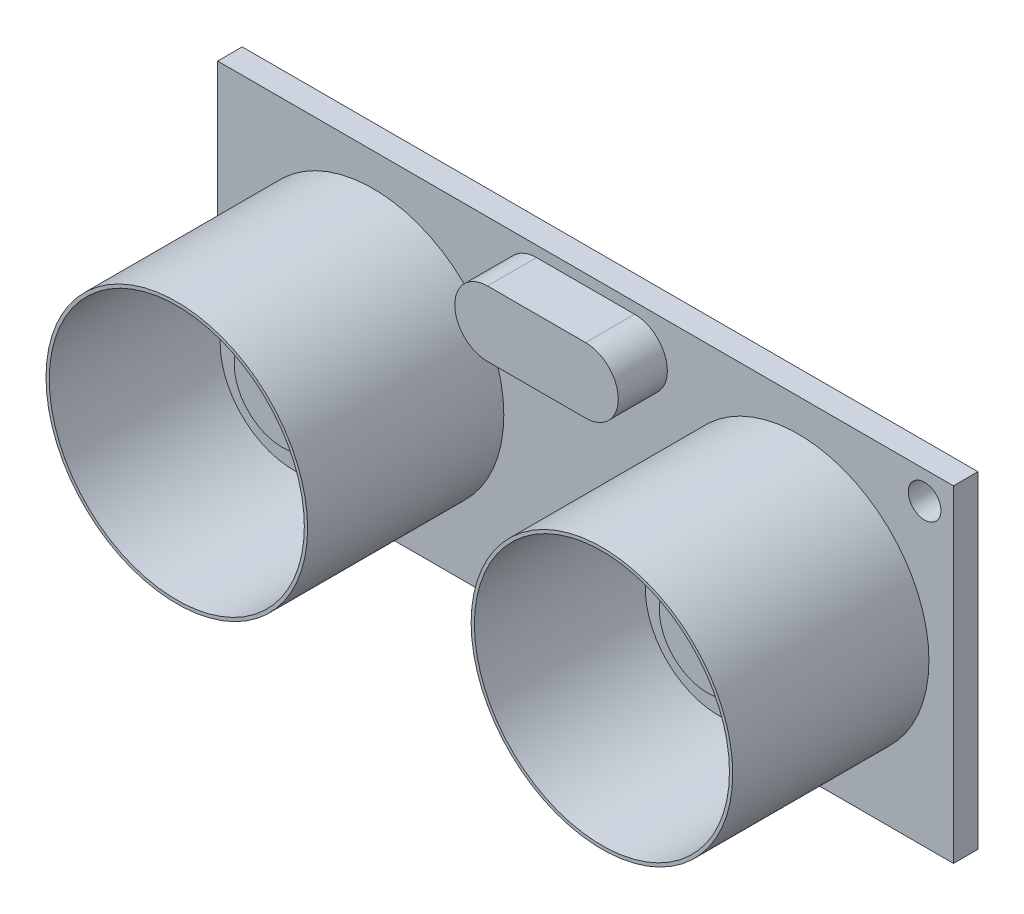
from build123d import *

# Parameters (mm, degrees)
CROQUIS1_W                = 45
CROQUIS1_H                = 20
CROQUIS1_R                = 1
SALIENTE_EXTRUIR1_DEPTH   = 1.5
CROQUIS2_R                = 8
SALIENTE_EXTRUIR2_DEPTH   = 12
CROQUIS4_W                = 2
CROQUIS4_H                = 2
SALIENTE_EXTRUIR4_DEPTH   = 2
REDONDEO3_R               = 0.2
SALIENTE_EXTRUIR6_DEPTH   = 3
VACIADO1_START            = 0.2
VACIADO1_OUTLINE_R        = 7.8
VACIADO1_DEPTH            = 13.1
VACIADO1_2_OUTLINE_W      = 44.6
VACIADO1_2_OUTLINE_H      = 19.6
VACIADO1_2_OUTLINE_R      = 1.2
VACIADO1_2_OUTLINE_R_2    = 7.8
VACIADO1_2_DEPTH          = 1.1
VACIADO1_START_2          = 1.3
VACIADO1_3_DEPTH          = 3
VACIADO1_START_3          = 13.3
VACIADO1_4_OUTLINE_R      = 7.8
VACIADO1_4_DEPTH          = 0.2
VACIADO1_START_4          = -1.8
VACIADO1_5_OUTLINE_W      = 7.6
VACIADO1_5_OUTLINE_H      = 1.6
VACIADO1_5_DEPTH          = 2
CROQUIS9_R                = 4.5
SALIENTE_EXTRUIR8_DEPTH   = 6.15
CROQUIS10_R               = 2.5
SALIENTE_EXTRUIR9_DEPTH   = 0.68
SALIENTE_EXTRUIR9_DRAFT   = -34
CORTAR_EXTRUIR1_START     = -12
CROQUIS12_R               = 7.8
CORTAR_EXTRUIR1_DEPTH     = 12
SIMETR_A3_COPY_1_SKETCH_R = 2.5
SIMETR_A3_COPY_1_DEPTH    = 0.68
SIMETR_A3_COPY_1_DRAFT    = -34


# Read off the part's stored shape, not the designer's step: Vaciado1
with BuildPart() as part:
    # Croquis1 → Saliente-Extruir1 (new body)
    with BuildSketch(Plane.XY):
        with Locations((0, 3.35)):
            Rectangle(CROQUIS1_W, CROQUIS1_H)
        with Locations((20.733115081, 11.657404702)):
            Circle(CROQUIS1_R, mode=Mode.SUBTRACT)
        with Locations((-20.266884919, -4.842595298)):
            Circle(CROQUIS1_R, mode=Mode.SUBTRACT)
    extrude(amount=SALIENTE_EXTRUIR1_DEPTH)

    # Croquis2 → Saliente-Extruir2 (add)
    with BuildSketch(Plane.XY.offset(1.5)):
        with Locations((-13, 3.35)):
            Circle(CROQUIS2_R)
        with Locations(Location((13, 3.35, 0), (0, 0, 180))):
            Circle(CROQUIS2_R)
    extrude(amount=SALIENTE_EXTRUIR2_DEPTH)

    # Croquis4 → Saliente-Extruir4 (add)
    with BuildSketch(Plane(origin=(0, 0, 0), x_dir=(-1, 0, 0), z_dir=(0, 0, -1))):
        with Locations((-3, -5.65)):
            Rectangle(CROQUIS4_W, CROQUIS4_H)
        with Locations((3, -5.65)):
            Rectangle(CROQUIS4_W, CROQUIS4_H)
        with Locations((1, -5.65)):
            Rectangle(CROQUIS4_W, CROQUIS4_H)
        with Locations((-1, -5.65)):
            Rectangle(CROQUIS4_W, CROQUIS4_H)
    extrude(amount=SALIENTE_EXTRUIR4_DEPTH)

    # Redondeo3
    redondeo3_edges = [part.edges().sort_by_distance(p)[0] for p in [
        (-4, -4.65, -1),
        (4, -4.65, -1),
        (4, -6.65, -1),
        (-4, -6.65, -1),
    ]]
    fillet(redondeo3_edges, radius=REDONDEO3_R)

    # Croquis6 → Saliente-Extruir6 (add)
    with BuildSketch(Plane.XY.offset(1.5)):
        with BuildLine():
            Line((-3, 12.689741285), (3, 12.689741285))
            ThreePointArc((3, 12.689741285), (5, 10.689741285), (3, 8.689741285))
            Line((3, 8.689741285), (-3, 8.689741285))
            ThreePointArc((-3, 8.689741285), (-5, 10.689741285), (-3, 12.689741285))
        make_face()
    extrude(amount=SALIENTE_EXTRUIR6_DEPTH)

    # Vaciado1 outline → Vaciado1 (cut)
    with BuildSketch(Plane.XY.offset(VACIADO1_START)):
        with Locations((-13, 3.35)):
            Circle(VACIADO1_OUTLINE_R)
        with Locations((13, 3.35)):
            Circle(VACIADO1_OUTLINE_R)
    extrude(amount=VACIADO1_DEPTH, mode=Mode.SUBTRACT)

    # Vaciado1 2 outline → Vaciado1 2 (cut)
    with BuildSketch(Plane.XY.offset(VACIADO1_START)):
        with Locations((0, 3.35)):
            Rectangle(VACIADO1_2_OUTLINE_W, VACIADO1_2_OUTLINE_H)
        with Locations((-20.266884919, -4.842595298)):
            Circle(VACIADO1_2_OUTLINE_R, mode=Mode.SUBTRACT)
        with Locations((-13, 3.35)):
            Circle(VACIADO1_2_OUTLINE_R_2, mode=Mode.SUBTRACT)
        with Locations((13, 3.35)):
            Circle(VACIADO1_2_OUTLINE_R_2, mode=Mode.SUBTRACT)
        with Locations((20.733115081, 11.657404702)):
            Circle(VACIADO1_2_OUTLINE_R, mode=Mode.SUBTRACT)
    extrude(amount=VACIADO1_2_DEPTH, mode=Mode.SUBTRACT)

    # Vaciado1 3 outline → Vaciado1 3 (cut)
    with BuildSketch(Plane.XY.offset(VACIADO1_START_2)):
        with BuildLine():
            ThreePointArc((-3, 12.489741285), (-4.8, 10.689741285), (-3, 8.889741285))
            Line((-3, 8.889741285), (3, 8.889741285))
            ThreePointArc((3, 8.889741285), (4.8, 10.689741285), (3, 12.489741285))
            Line((3, 12.489741285), (-3, 12.489741285))
        make_face()
    extrude(amount=VACIADO1_3_DEPTH, mode=Mode.SUBTRACT)

    # Vaciado1 4 outline → Vaciado1 4 (cut)
    with BuildSketch(Plane.XY.offset(VACIADO1_START_3)):
        with Locations((13, 3.35)):
            Circle(VACIADO1_4_OUTLINE_R)
    extrude(amount=VACIADO1_4_DEPTH, mode=Mode.SUBTRACT)

    # Vaciado1 5 outline → Vaciado1 5 (cut)
    with BuildSketch(Plane.XY.offset(VACIADO1_START_4)):
        with Locations((0, -5.65)):
            Rectangle(VACIADO1_5_OUTLINE_W, VACIADO1_5_OUTLINE_H)
    extrude(amount=VACIADO1_5_DEPTH, mode=Mode.SUBTRACT)

    # Croquis9 → Saliente-Extruir8 (add)
    with BuildSketch(Plane.XY.offset(0.2)):
        with Locations((13, 3.35)):
            Circle(CROQUIS9_R)
    saliente_extruir8 = extrude(amount=SALIENTE_EXTRUIR8_DEPTH)


with BuildPart() as saliente_extruir9_tool:
    # Croquis10 → Saliente-Extruir9 (with draft: the straight prism first)
    with BuildSketch(Plane.XY.offset(6.35)):
        with Locations((13, 3.35)):
            Circle(CROQUIS10_R)
    extrude(amount=SALIENTE_EXTRUIR9_DEPTH)
    # Saliente-Extruir9: the draft: its side faces are tilted about the plane it starts from
    saliente_extruir9_sides = [saliente_extruir9_tool.faces().sort_by_distance(p)[0] for p in [
        (10.5, 3.35, 6.69),
    ]]
    draft(saliente_extruir9_sides, Plane.XY.offset(6.35), SALIENTE_EXTRUIR9_DRAFT)


with BuildPart() as part_1:
    add(part.part)

    # Saliente-Extruir9: add saliente_extruir9_tool
    add(saliente_extruir9_tool.part)

    # Croquis12 → Cortar-Extruir1 (cut)
    with BuildSketch(Plane.XY.offset(13.5).offset(CORTAR_EXTRUIR1_START)):
        with Locations((-13, 3.35)):
            Circle(CROQUIS12_R)
    extrude(amount=CORTAR_EXTRUIR1_DEPTH, mode=Mode.SUBTRACT)

    # Simetría3: Saliente-Extruir8 across plane
    add(saliente_extruir8.mirror(Plane(origin=(0, 0, 0), x_dir=(0, 0, 1), z_dir=(1, 0, 0))))


with BuildPart() as simetr_a3_copy_1_tool:
    # Simetría3 copy 1 sketch → Simetría3 copy 1 (with draft: the straight prism first)
    with BuildSketch(Plane(origin=(0, 0, 6.35), x_dir=(-1, 0, 0), z_dir=(0, 0, 1))):
        with Locations((13, -3.35)):
            Circle(SIMETR_A3_COPY_1_SKETCH_R)
    extrude(amount=SIMETR_A3_COPY_1_DEPTH)
    # Simetría3 copy 1: the draft: its side faces are tilted about the plane it starts from
    simetr_a3_copy_1_sides = [simetr_a3_copy_1_tool.faces().sort_by_distance(p)[0] for p in [
        (-10.5, 3.35, 6.69),
    ]]
    draft(simetr_a3_copy_1_sides, Plane(origin=(0, 0, 6.35), x_dir=(-1, 0, 0), z_dir=(0, 0, 1)), SIMETR_A3_COPY_1_DRAFT)


with BuildPart() as part_2:
    add(part_1.part)

    # Simetría3 copy 1: add simetr_a3_copy_1_tool
    add(simetr_a3_copy_1_tool.part)


solid = part_2.part
